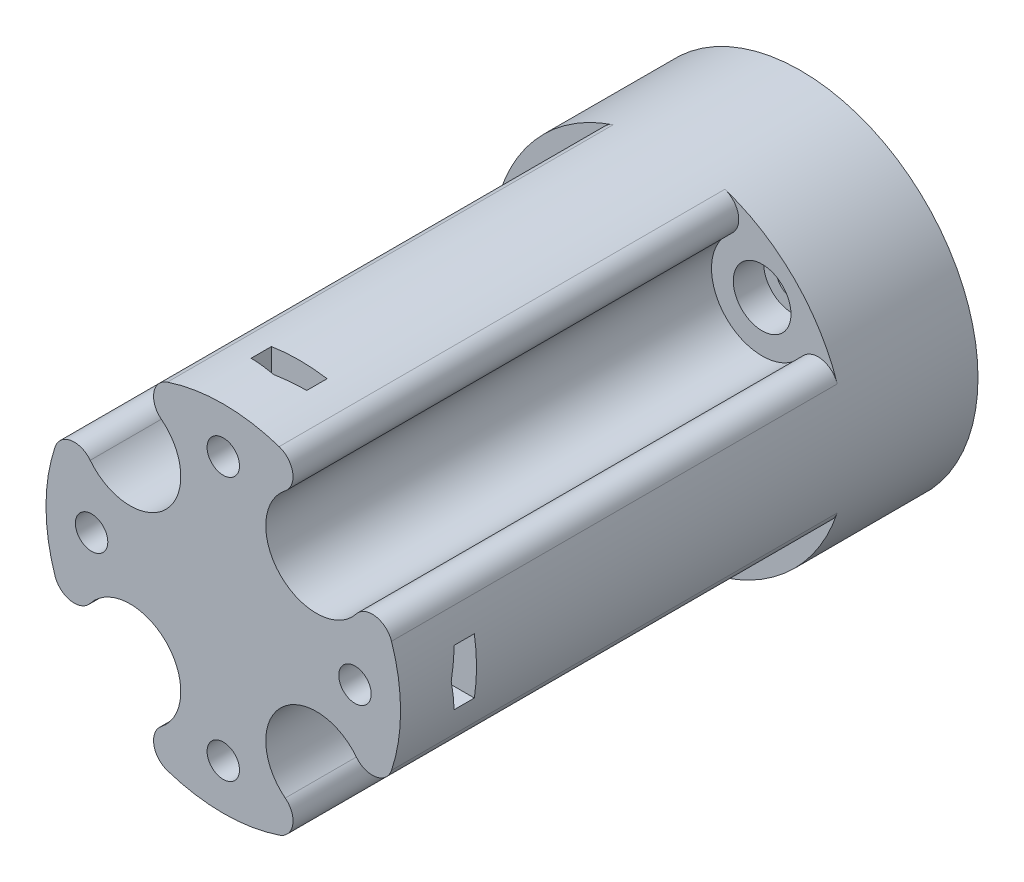
from build123d import *

# Parameters (mm, degrees)
SKETCH1_R           = 17.5
SKETCH1_R_2         = 2.85
BOSS_EXTRUDE1_DEPTH = 57
SKETCH1_3_R         = 2.85
SKETCH1_3_R_2       = 1.6
BOSS_EXTRUDE2_DEPTH = 10
SKETCH2_R           = 5
CUT_EXTRUDE1_DEPTH  = 44
FILLET1_R           = 2
CUT_EXTRUDE2_START  = -7.5
SKETCH3_R           = 1.6
CUT_EXTRUDE2_DEPTH  = 2.5
CUT_EXTRUDE3_START  = -10
SKETCH3_2_R         = 1.6
CUT_EXTRUDE3_DEPTH  = 10
CHAMFER1_SIZE       = 2.75
CHAMFER1_SIZE_2     = 0.5


with BuildPart() as part:
    # Sketch1 → Boss-Extrude1 (new body)
    with BuildSketch(Plane(origin=(0, 0, 0), x_dir=(0, 1, 0), z_dir=(0, 0, 1))):
        with Locations(Location((0, 0, 0), (0, 0, 90))):
            Circle(SKETCH1_R)
        with Locations(Location((-9.192388155, 9.192388155, 0), (0, 0, 90))):
            Circle(SKETCH1_R_2, mode=Mode.SUBTRACT)
        with Locations(Location((-9.192388155, -9.192388155, 0), (0, 0, 90))):
            Circle(SKETCH1_R_2, mode=Mode.SUBTRACT)
        with Locations(Location((9.192388155, -9.192388155, 0), (0, 0, 90))):
            Circle(SKETCH1_R_2, mode=Mode.SUBTRACT)
        with Locations(Location((9.192388155, 9.192388155, 0), (0, 0, 90))):
            Circle(SKETCH1_R_2, mode=Mode.SUBTRACT)
    extrude(amount=BOSS_EXTRUDE1_DEPTH)

    # Sketch1<3> → Boss-Extrude2 (add)
    # profile 1 of 4: a face of its own
    with BuildSketch(Plane(origin=(0, 0, 0), x_dir=(0, 1, 0), z_dir=(0, 0, 1))):
        with Locations(Location((-9.192388155, -9.192388155, 0), (0, 0, 90))):
            Circle(SKETCH1_3_R)
        with Locations(Location((-9.192388155, -9.192388155, 0), (0, 0, 270))):
            Circle(SKETCH1_3_R_2, mode=Mode.SUBTRACT)
    # profile 2 of 4: a face of its own
    with BuildSketch(Plane(origin=(0, 0, 0), x_dir=(0, 1, 0), z_dir=(0, 0, 1))):
        with Locations(Location((-9.192388155, 9.192388155, 0), (0, 0, 90))):
            Circle(SKETCH1_3_R)
        with Locations(Location((-9.192388155, 9.192388155, 0), (0, 0, 270))):
            Circle(SKETCH1_3_R_2, mode=Mode.SUBTRACT)
    # profile 3 of 4: a face of its own
    with BuildSketch(Plane(origin=(0, 0, 0), x_dir=(0, 1, 0), z_dir=(0, 0, 1))):
        with Locations(Location((9.192388155, -9.192388155, 0), (0, 0, 90))):
            Circle(SKETCH1_3_R)
        with Locations(Location((9.192388155, -9.192388155, 0), (0, 0, 270))):
            Circle(SKETCH1_3_R_2, mode=Mode.SUBTRACT)
    # profile 4 of 4: a face of its own
    with BuildSketch(Plane(origin=(0, 0, 0), x_dir=(0, 1, 0), z_dir=(0, 0, 1))):
        with Locations(Location((9.192388155, 9.192388155, 0), (0, 0, 90))):
            Circle(SKETCH1_3_R)
        with Locations(Location((9.192388155, 9.192388155, 0), (0, 0, 270))):
            Circle(SKETCH1_3_R_2, mode=Mode.SUBTRACT)
    extrude(amount=BOSS_EXTRUDE2_DEPTH)

    # Sketch2 → Cut-Extrude1 (cut)
    with BuildSketch(Plane.XY.offset(57)):
        with Locations((-9.192388155, 9.192388155)):
            Circle(SKETCH2_R)
        with Locations((9.192388155, 9.192388155)):
            Circle(SKETCH2_R)
        with Locations((9.192388155, -9.192388155)):
            Circle(SKETCH2_R)
        with Locations((-9.192388155, -9.192388155)):
            Circle(SKETCH2_R)
    extrude(amount=-CUT_EXTRUDE1_DEPTH, mode=Mode.SUBTRACT)

    # Fillet1
    fillet1_edges = [part.edges().sort_by_distance(p)[0] for p in [
        (-14.028560913, -10.46181049, 35),
        (-10.46181049, -14.028560913, 35),
        (10.46181049, -14.028560913, 35),
        (14.028560913, -10.46181049, 35),
        (14.028560913, 10.46181049, 35),
        (10.46181049, 14.028560913, 35),
        (-10.46181049, 14.028560913, 35),
        (-14.028560913, 10.46181049, 35),
    ]]
    fillet(fillet1_edges, radius=FILLET1_R)

    # Sketch3 → Cut-Extrude2 (cut)
    # profile 1 of 4: a face of its own
    with BuildSketch(Plane.XY.offset(57).offset(CUT_EXTRUDE2_START)):
        with BuildLine():
            Line((-2.75, 15.75), (-2.75, 17.282577933))
            ThreePointArc((-2.75, 17.282577933), (0, 17.5), (2.75, 17.282577933))
            Line((2.75, 17.282577933), (2.75, 15.75))
            Line((2.75, 15.75), (2.75, 10.25))
            Line((2.75, 10.25), (-2.75, 10.25))
            Line((-2.75, 10.25), (-2.75, 15.75))
        make_face()
        with Locations((0, 13)):
            Circle(SKETCH3_R, mode=Mode.SUBTRACT)
    # profile 2 of 4: a face of its own
    with BuildSketch(Plane.XY.offset(57).offset(CUT_EXTRUDE2_START)):
        with BuildLine():
            Line((15.75, -2.75), (10.25, -2.75))
            Line((10.25, -2.75), (10.25, 2.75))
            Line((10.25, 2.75), (15.75, 2.75))
            Line((15.75, 2.75), (17.282577933, 2.75))
            ThreePointArc((17.282577933, 2.75), (17.5, 0), (17.282577933, -2.75))
            Line((17.282577933, -2.75), (15.75, -2.75))
        make_face()
        with Locations((13, 0)):
            Circle(SKETCH3_R, mode=Mode.SUBTRACT)
    # profile 3 of 4: a face of its own
    with BuildSketch(Plane.XY.offset(57).offset(CUT_EXTRUDE2_START)):
        with BuildLine():
            Line((-2.75, -15.75), (-2.75, -10.25))
            Line((-2.75, -10.25), (2.75, -10.25))
            Line((2.75, -10.25), (2.75, -15.75))
            Line((2.75, -15.75), (2.75, -17.282577933))
            ThreePointArc((2.75, -17.282577933), (0, -17.5), (-2.75, -17.282577933))
            Line((-2.75, -17.282577933), (-2.75, -15.75))
        make_face()
        with Locations((0, -13)):
            Circle(SKETCH3_R, mode=Mode.SUBTRACT)
    # profile 4 of 4: a face of its own
    with BuildSketch(Plane.XY.offset(57).offset(CUT_EXTRUDE2_START)):
        with BuildLine():
            Line((-15.75, 2.75), (-10.25, 2.75))
            Line((-10.25, 2.75), (-10.25, -2.75))
            Line((-10.25, -2.75), (-15.75, -2.75))
            Line((-15.75, -2.75), (-17.282577933, -2.75))
            ThreePointArc((-17.282577933, -2.75), (-17.5, 0), (-17.282577933, 2.75))
            Line((-17.282577933, 2.75), (-15.75, 2.75))
        make_face()
        with Locations((-13, 0)):
            Circle(SKETCH3_R, mode=Mode.SUBTRACT)
    extrude(amount=CUT_EXTRUDE2_DEPTH, mode=Mode.SUBTRACT)

    # Sketch3<2> → Cut-Extrude3 (cut)
    with BuildSketch(Plane.XY.offset(57).offset(CUT_EXTRUDE3_START)):
        with Locations((-13, 0)):
            Circle(SKETCH3_2_R)
        with Locations((0, 13)):
            Circle(SKETCH3_2_R)
        with Locations((13, 0)):
            Circle(SKETCH3_2_R)
        with Locations((0, -13)):
            Circle(SKETCH3_2_R)
    extrude(amount=CUT_EXTRUDE3_DEPTH, mode=Mode.SUBTRACT)

    # Chamfer1
    # the kernel refuses this chamfer: 2.75, 0.5 mm, written as the material it adds along each edge
    with BuildSketch(Plane(origin=(-3.104266441, -2.75, 52), x_dir=(1.0355932807417332e-14, 0.9999763028084744, 0.006884317068104265), z_dir=(-1, 0, 0))) as chamfer1_piece_1_section:
        Polygon((CHAMFER1_SIZE * 0.999976302808, CHAMFER1_SIZE * 0.0068843170681), (-CHAMFER1_SIZE_2 * 0.0068843170681, CHAMFER1_SIZE_2 * 0.999976302808), (0, 0), align=None)
    chamfer1_piece_1 = extrude(amount=21.324045051, mode=Mode.PRIVATE)
    chamfer1_piece_1 = chamfer1_piece_1 & Plane(origin=(0, 0, 51.863927103), x_dir=(-1, 0, 0), z_dir=(0, 0, -1)) * Cylinder(17.5, 54, mode=Mode.PRIVATE)
    chamfer1_piece_1 = chamfer1_piece_1 - Plane(origin=(-13, 0, 51.863927103), x_dir=(1, 0, 0), z_dir=(0, 0, -1)) * Cylinder(1.6, 54, mode=Mode.PRIVATE)
    add(chamfer1_piece_1)
    with BuildSketch(Plane(origin=(-24.428311492, 2.75, 52), x_dir=(-1.048222467092242e-14, -0.9999763028084744, 0.006884317068104265), z_dir=(1, 0, 0))) as chamfer1_piece_2_section:
        Polygon((CHAMFER1_SIZE * 0.999976302808, CHAMFER1_SIZE * 0.0068843170681), (-CHAMFER1_SIZE_2 * 0.0068843170681, CHAMFER1_SIZE_2 * 0.999976302808), (0, 0), align=None)
    chamfer1_piece_2 = extrude(amount=21.324045051, mode=Mode.PRIVATE)
    chamfer1_piece_2 = chamfer1_piece_2 & Plane(origin=(0, 0, 51.852070579), x_dir=(-1, 0, 0), z_dir=(0, 0, -1)) * Cylinder(17.5, 54, mode=Mode.PRIVATE)
    chamfer1_piece_2 = chamfer1_piece_2 - Plane(origin=(-13, 0, 51.852070579), x_dir=(1, 0, 0), z_dir=(0, 0, -1)) * Cylinder(1.6, 54, mode=Mode.PRIVATE)
    add(chamfer1_piece_2)
    with BuildSketch(Plane(origin=(-2.75, 3.104266441, 52), x_dir=(0.9999763028084744, 0, 0.006884317068104265), z_dir=(0, 1, 0))) as chamfer1_piece_3_section:
        Polygon((CHAMFER1_SIZE * 0.999976302808, CHAMFER1_SIZE * 0.0068843170681), (-CHAMFER1_SIZE_2 * 0.0068843170681, CHAMFER1_SIZE_2 * 0.999976302808), (0, 0), align=None)
    chamfer1_piece_3 = extrude(amount=21.324045051, mode=Mode.PRIVATE)
    chamfer1_piece_3 = chamfer1_piece_3 & Plane(origin=(0, 0, 51.863927103), x_dir=(-1, 0, 0), z_dir=(0, 0, -1)) * Cylinder(17.5, 54, mode=Mode.PRIVATE)
    chamfer1_piece_3 = chamfer1_piece_3 - Plane(origin=(0, 13, 51.863927103), x_dir=(1, 0, 0), z_dir=(0, 0, -1)) * Cylinder(1.6, 54, mode=Mode.PRIVATE)
    add(chamfer1_piece_3)
    with BuildSketch(Plane(origin=(2.75, 24.428311492, 52), x_dir=(0.20388124945923355, 0, -0.9789956262001082), z_dir=(0, -1, 0))) as chamfer1_piece_4_section:
        Polygon((CHAMFER1_SIZE_2 * 0.9789956262, -CHAMFER1_SIZE_2 * 0.203881249459), (-CHAMFER1_SIZE * 0.203881249459, -CHAMFER1_SIZE * 0.9789956262), (0, 0), align=None)
    chamfer1_piece_4 = extrude(amount=21.324045051, mode=Mode.PRIVATE)
    chamfer1_piece_4 = chamfer1_piece_4 & Plane(origin=(0, 0, 51.852070749), x_dir=(-1, 0, 0), z_dir=(0, 0, -1)) * Cylinder(17.5, 54, mode=Mode.PRIVATE)
    chamfer1_piece_4 = chamfer1_piece_4 - Plane(origin=(0, 13, 51.852070749), x_dir=(1, 0, 0), z_dir=(0, 0, -1)) * Cylinder(1.6, 54, mode=Mode.PRIVATE)
    add(chamfer1_piece_4)
    with BuildSketch(Plane(origin=(3.104266441, 2.75, 52), x_dir=(-3.409880314637416e-15, -0.9999763028084744, 0.006884317068104265), z_dir=(1, 0, 0))) as chamfer1_piece_5_section:
        Polygon((CHAMFER1_SIZE * 0.999976302808, CHAMFER1_SIZE * 0.0068843170681), (-CHAMFER1_SIZE_2 * 0.0068843170681, CHAMFER1_SIZE_2 * 0.999976302808), (0, 0), align=None)
    chamfer1_piece_5 = extrude(amount=21.324045051, mode=Mode.PRIVATE)
    chamfer1_piece_5 = chamfer1_piece_5 & Plane(origin=(0, 0, 51.863927103), x_dir=(-1, 0, 0), z_dir=(0, 0, -1)) * Cylinder(17.5, 54, mode=Mode.PRIVATE)
    chamfer1_piece_5 = chamfer1_piece_5 - Plane(origin=(13, 0, 51.863927103), x_dir=(1, 0, 0), z_dir=(0, 0, -1)) * Cylinder(1.6, 54, mode=Mode.PRIVATE)
    add(chamfer1_piece_5)
    with BuildSketch(Plane(origin=(24.428311492, -2.75, 52), x_dir=(0, -0.20388124945923355, -0.9789956262001082), z_dir=(-1, 0, 0))) as chamfer1_piece_6_section:
        Polygon((CHAMFER1_SIZE_2 * 0.9789956262, -CHAMFER1_SIZE_2 * 0.203881249459), (-CHAMFER1_SIZE * 0.203881249459, -CHAMFER1_SIZE * 0.9789956262), (0, 0), align=None)
    chamfer1_piece_6 = extrude(amount=21.324045051, mode=Mode.PRIVATE)
    chamfer1_piece_6 = chamfer1_piece_6 & Plane(origin=(0, 0, 51.852070888), x_dir=(-1, 0, 0), z_dir=(0, 0, -1)) * Cylinder(17.5, 54, mode=Mode.PRIVATE)
    chamfer1_piece_6 = chamfer1_piece_6 - Plane(origin=(13, 0, 51.852070888), x_dir=(1, 0, 0), z_dir=(0, 0, -1)) * Cylinder(1.6, 54, mode=Mode.PRIVATE)
    add(chamfer1_piece_6)
    with BuildSketch(Plane(origin=(2.75, -3.104266441, 52), x_dir=(-0.9999763028084744, 6.88290656102737e-15, 0.006884317068104265), z_dir=(0, -1, 0))) as chamfer1_piece_7_section:
        Polygon((CHAMFER1_SIZE * 0.999976302808, CHAMFER1_SIZE * 0.0068843170681), (-CHAMFER1_SIZE_2 * 0.0068843170681, CHAMFER1_SIZE_2 * 0.999976302808), (0, 0), align=None)
    chamfer1_piece_7 = extrude(amount=21.324045051, mode=Mode.PRIVATE)
    chamfer1_piece_7 = chamfer1_piece_7 & Plane(origin=(0, 0, 51.863927103), x_dir=(-1, 0, 0), z_dir=(0, 0, -1)) * Cylinder(17.5, 54, mode=Mode.PRIVATE)
    chamfer1_piece_7 = chamfer1_piece_7 - Plane(origin=(0, -13, 51.863927103), x_dir=(1, 0, 0), z_dir=(0, 0, -1)) * Cylinder(1.6, 54, mode=Mode.PRIVATE)
    add(chamfer1_piece_7)
    with BuildSketch(Plane(origin=(-2.75, -24.428311492, 52), x_dir=(-0.20388124945923355, 1.4290779976363847e-15, -0.9789956262001082), z_dir=(0, 1, 0))) as chamfer1_piece_8_section:
        Polygon((CHAMFER1_SIZE_2 * 0.9789956262, -CHAMFER1_SIZE_2 * 0.203881249459), (-CHAMFER1_SIZE * 0.203881249459, -CHAMFER1_SIZE * 0.9789956262), (0, 0), align=None)
    chamfer1_piece_8 = extrude(amount=21.324045051, mode=Mode.PRIVATE)
    chamfer1_piece_8 = chamfer1_piece_8 & Plane(origin=(0, 0, 51.852070422), x_dir=(-1, 0, 0), z_dir=(0, 0, -1)) * Cylinder(17.5, 54, mode=Mode.PRIVATE)
    chamfer1_piece_8 = chamfer1_piece_8 - Plane(origin=(0, -13, 51.852070422), x_dir=(1, 0, 0), z_dir=(0, 0, -1)) * Cylinder(1.6, 54, mode=Mode.PRIVATE)
    add(chamfer1_piece_8)


solid = part.part
